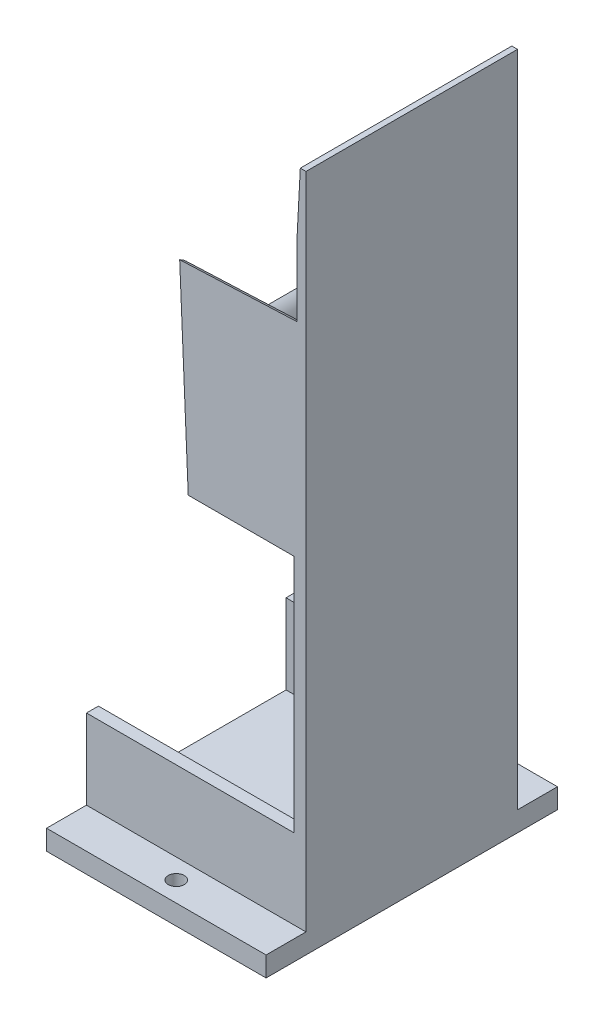
from build123d import *

# Parameters (mm, degrees)
CROQUIS1_W              = 55
CROQUIS1_H              = 53
CROQUIS1_W_2            = 48.773584906
CROQUIS1_H_2            = 47
SALIENTE_EXTRUIR1_DEPTH = 25
SALIENTE_EXTRUIR2_DEPTH = 160
SALIENTE_EXTRUIR3_DEPTH = 50
SALIENTE_EXTRUIR5_DEPTH = 3
CROQUIS4_W              = 100
CROQUIS4_H              = 30
CORTAR_EXTRUIR1_DEPTH   = 63
CHAFL_N1_SIZE           = 2
CHAFL_N1_SIZE2          = 57.272506566
CROQUIS1_2_W            = 55
CROQUIS1_2_H            = 53
CROQUIS1_2_W_2          = 48.773584906
CROQUIS1_2_H_2          = 47
SALIENTE_EXTRUIR6_DEPTH = 5
CROQUIS5_W              = 30
CROQUIS5_H              = 60
CORTAR_EXTRUIR2_DEPTH   = 60
CROQUIS1_4_W            = 55
CROQUIS1_4_H            = 10
CROQUIS1_4_R            = 2
SALIENTE_EXTRUIR7_DEPTH = 5
CROQUIS6_W              = 53
CROQUIS6_H              = 15
CORTAR_EXTRUIR3_DEPTH   = 5
CHAFL_N2_SIZE           = 30
CHAFL_N2_SIZE_2         = 1.572233378
CHAFL_N3_SIZE           = 5
CHAFL_N3_SIZE2          = 0.881634904
CROQUIS7_W              = 47
CROQUIS7_H              = 20
CORTAR_EXTRUIR4_DEPTH   = 40
CROQUIS8_W              = 47
CROQUIS8_H              = 40
CORTAR_EXTRUIR5_DEPTH   = 10
CORTAR_EXTRUIR6_DEPTH   = 70
REDONDEO3_R             = 5
REDONDEO5_R             = 5


with BuildPart() as part:
    # Croquis1 → Saliente-Extruir1 (new body)
    with BuildSketch(Plane(origin=(0, 0, 0), x_dir=(1, 0, 0), z_dir=(0, 1, 0))):
        Rectangle(CROQUIS1_W, CROQUIS1_H)
        Rectangle(CROQUIS1_W_2, CROQUIS1_H_2, mode=Mode.SUBTRACT)
    extrude(amount=SALIENTE_EXTRUIR1_DEPTH)

    # Croquis2 → Saliente-Extruir2 (add)
    with BuildSketch(Plane(origin=(0, 25, 0), x_dir=(1, 0, 0), z_dir=(0, 1, 0))):
        Polygon((0, 23.5), (0, 26.5), (27.5, 26.5), (27.5, -26.5), (0, -26.5), (0, -23.5), (24.386792453, -23.5), (24.386792453, 23.5), align=None)
    extrude(amount=SALIENTE_EXTRUIR2_DEPTH)



with BuildPart() as body_2:
    # Croquis3 → Saliente-Extruir3 (new body)
    with BuildSketch(Plane(origin=(0, 0, 23.5), x_dir=(-1, 0, 0), z_dir=(0, 0, -1))):
        Polygon((0, 155), (5, 155), (2, 85), (0, 85), align=None)
    extrude(amount=SALIENTE_EXTRUIR3_DEPTH)


with BuildPart() as part_1:
    add(part.part)

    add(body_2.part)  # Saliente-Extruir5 merges body 2
    # Croquis3<4> → Saliente-Extruir5 (add)
    with BuildSketch(Plane(origin=(0, 0, 23.5), x_dir=(-1, 0, 0), z_dir=(0, 0, -1))):
        Polygon((0, 155), (5, 155), (2, 85), (0, 85), align=None)
    extrude(amount=-SALIENTE_EXTRUIR5_DEPTH)

    # Croquis4 → Cortar-Extruir1 (cut)
    with BuildSketch(Plane(origin=(0, 0, -26.5), x_dir=(-1, 0, 0), z_dir=(0, 0, -1))):
        with Locations((25.5, 170)):
            Rectangle(CROQUIS4_W, CROQUIS4_H)
    extrude(amount=-CORTAR_EXTRUIR1_DEPTH, mode=Mode.SUBTRACT)

    # Chaflán1
    chafl_n1_edges = [part_1.edges().sort_by_distance(p)[0] for p in [
        (0, 155, 0),
    ]]
    chafl_n1_side = [part_1.faces().sort_by_distance(p)[0] for p in [
        (9.75, 155, -25.893431785),
    ]]
    chamfer(chafl_n1_edges, length=CHAFL_N1_SIZE, length2=CHAFL_N1_SIZE2, reference=chafl_n1_side[0])

    # Croquis1<2> → Saliente-Extruir6 (add)
    # profile 1 of 2: a face of its own
    with BuildSketch(Plane(origin=(0, 0, 0), x_dir=(1, 0, 0), z_dir=(0, 1, 0))):
        Rectangle(CROQUIS1_2_W, CROQUIS1_2_H)
        Rectangle(CROQUIS1_2_W_2, CROQUIS1_2_H_2, mode=Mode.SUBTRACT)
    # profile 2 of 2: a face of its own
    with BuildSketch(Plane(origin=(0, 0, 0), x_dir=(1, 0, 0), z_dir=(0, 1, 0))):
        Rectangle(CROQUIS1_2_W_2, CROQUIS1_2_H_2)
    extrude(amount=SALIENTE_EXTRUIR6_DEPTH)

    # Croquis5 → Cortar-Extruir2 (cut)
    with BuildSketch(Plane(origin=(0, 0, -26.5), x_dir=(-1, 0, 0), z_dir=(0, 0, -1))):
        with Locations((-9.5, 55)):
            Rectangle(CROQUIS5_W, CROQUIS5_H)
    extrude(amount=-CORTAR_EXTRUIR2_DEPTH, mode=Mode.SUBTRACT)

    # Croquis1<4> → Saliente-Extruir7 (add)
    # profile 1 of 2: a face of its own
    with BuildSketch(Plane(origin=(0, 0, 0), x_dir=(1, 0, 0), z_dir=(0, 1, 0))):
        with Locations((0, 31.5)):
            Rectangle(CROQUIS1_4_W, CROQUIS1_4_H)
        with Locations(Location((0, 31.5, 0), (0, 0, 270))):
            Circle(CROQUIS1_4_R, mode=Mode.SUBTRACT)
    # profile 2 of 2: a face of its own
    with BuildSketch(Plane(origin=(0, 0, 0), x_dir=(1, 0, 0), z_dir=(0, 1, 0))):
        with Locations((0, -31.5)):
            Rectangle(CROQUIS1_4_W, CROQUIS1_4_H)
        with Locations(Location((0, -31.5, 0), (0, 0, 270))):
            Circle(CROQUIS1_4_R, mode=Mode.SUBTRACT)
    extrude(amount=SALIENTE_EXTRUIR7_DEPTH)

    # Croquis6 → Cortar-Extruir3 (cut)
    with BuildSketch(Plane.ZY.offset(-24.5)):
        with Locations((0, 177.5)):
            Rectangle(CROQUIS6_W, CROQUIS6_H)
    extrude(amount=-CORTAR_EXTRUIR3_DEPTH, mode=Mode.SUBTRACT)

    # Chaflán2
    # the kernel refuses this chamfer: 30, 1.572233378 mm, written as the material it takes off along each edge
    with BuildSketch(Plane(origin=(24.5, 170, -104.496046635), x_dir=(-0.002013023422382327, -0.9999979738662979, 0), z_dir=(0, 0, 1))) as chafl_n2_piece_1_section:
        Polygon((CHAFL_N2_SIZE * 0.999997973866, CHAFL_N2_SIZE * 0.00201302342238), (-CHAFL_N2_SIZE_2 * 0.00201302342301, CHAFL_N2_SIZE_2 * 0.999997974179), (0, 0), align=None)
    chafl_n2_piece_1 = extrude(amount=208.992093269, mode=Mode.PRIVATE)
    chafl_n2_piece_1 = split(chafl_n2_piece_1, bisect_by=Plane(origin=(25.111424092, 155, 0), z_dir=(0, 1, 0)), keep=Keep.TOP, mode=Mode.PRIVATE)
    add(chafl_n2_piece_1, mode=Mode.SUBTRACT)

    # Chaflán3
    chafl_n3_edges = [part_1.edges().sort_by_distance(p)[0] for p in [
        (24.386792453, 155, 0),
    ]]
    chafl_n3_side = [part_1.faces().sort_by_distance(p)[0] for p in [
        (24.386792453, 120, 0),
    ]]
    chamfer(chafl_n3_edges, length=CHAFL_N3_SIZE, length2=CHAFL_N3_SIZE2, reference=chafl_n3_side[0])

    # Croquis7 → Cortar-Extruir4 (cut)
    with BuildSketch(Plane.ZY.offset(27.5)):
        with Locations((0, 15)):
            Rectangle(CROQUIS7_W, CROQUIS7_H)
    extrude(amount=-CORTAR_EXTRUIR4_DEPTH, mode=Mode.SUBTRACT)

    # Croquis8 → Cortar-Extruir5 (cut)
    with BuildSketch(Plane(origin=(1.639845182, 0.070279079, 0), x_dir=(0, 0, 1), z_dir=(-0.9990828958176697, -0.04281783839218585, 0))):
        with Locations((0, 135.071938044)):
            Rectangle(CROQUIS8_W, CROQUIS8_H)
    extrude(amount=-CORTAR_EXTRUIR5_DEPTH, mode=Mode.SUBTRACT)

    # Croquis9 → Cortar-Extruir6 (cut)
    with BuildSketch(Plane.XY.offset(26.5)):
        Polygon((-5, 155), (25.286116689, 155), (25.286116689, 136.279617509), (-4.143643232, 135.018342084), align=None)
    extrude(amount=-CORTAR_EXTRUIR6_DEPTH, mode=Mode.SUBTRACT)

    # Redondeo3
    # the kernel refuses this fillet: 5 mm, written as the material it takes off along each edge
    with BuildSketch(Plane(origin=(-4.143643232, 135.018342084, 23.5), x_dir=(0, 0, 1), z_dir=(0.9990828958176697, 0.042817838392185704, 0))) as redondeo3_piece_1_section:
        with BuildLine():
            CenterArc((5, 4.582575695), REDONDEO3_R, 180, 66.421821522)
            Line((0, 4.582575695), (-0.1, 4.582575695))
            Line((-0.1, 4.582575695), (-0.1, 0))
            Line((-0.1, 0), (0, -0.1))
            ThreePointArc((0, -0.1), (1.5, -0.1), (2.96, -0.091651514))
            Line((2.96, -0.091651514), (3, 0))
        make_face()
    redondeo3_piece_1 = extrude(amount=40.013064323, mode=Mode.PRIVATE)
    redondeo3_piece_1 = split(redondeo3_piece_1, bisect_by=Plane(origin=(24.386792453, 134.515316135, 24.276456874), z_dir=(-1, 0, 0)), keep=Keep.TOP, mode=Mode.PRIVATE)
    add(redondeo3_piece_1, mode=Mode.SUBTRACT)
    with BuildSketch(Plane(origin=(24.386792453, 136.241075042, 23.5), x_dir=(0.9990828958176863, 0.04281783839180005, 0), z_dir=(0, 0, -1))) as redondeo3_piece_2:
        with BuildLine():
            CenterArc((4.874569404, 3.033807599), REDONDEO3_R, 182.454031675, 34.901674654)
            Line((-0.120845075, 2.819718407), (-0.220753364, 2.815436623))
            Line((-0.220753364, 2.815436623), (-0.09990829, -0.004281784))
            Line((-0.09990829, -0.004281784), (0, -0.1))
            ThreePointArc((0, -0.1), (0.450074884, -0.1), (0.820661375, -0.060676152))
            Line((0.820661375, -0.060676152), (0.900149768, 0))
        make_face()
    extrude(amount=47, mode=Mode.SUBTRACT)
    with BuildSketch(Plane(origin=(35.832724942, 136.731615005, -23.5), x_dir=(0.0428178383921857, -0.9990828958176697, 0), z_dir=(-0.9990828958176697, -0.042817838392185704, 0))) as redondeo3_piece_3_section:
        with BuildLine():
            CenterArc((4.582575695, -5), REDONDEO3_R, 90, 66.421821522)
            Line((0, -3), (-0.091651514, -2.96))
            ThreePointArc((-0.091651514, -2.96), (-0.1, -1.5), (-0.1, 0))
            Line((-0.1, 0), (0, 0.1))
            Line((0, 0.1), (4.582575695, 0.1))
            Line((4.582575695, 0.1), (4.582575695, 0))
        make_face()
    redondeo3_piece_3 = extrude(amount=40.013064323, mode=Mode.PRIVATE)
    redondeo3_piece_3 = split(redondeo3_piece_3, bisect_by=Plane(origin=(24.386792453, 134.515316135, -24.276456874), z_dir=(-1, 0, 0)), keep=Keep.TOP, mode=Mode.PRIVATE)
    add(redondeo3_piece_3, mode=Mode.SUBTRACT)
    with BuildSketch(Plane(origin=(-4.143643232, 135.018342084, 23.5), x_dir=(0, 0, 1), z_dir=(0.9990828958176697, 0.042817838392185704, 0))) as redondeo3_piece_4a_section:
        with BuildLine():
            CenterArc((5, 4.582575695), REDONDEO3_R, 180, 66.421821522)
            Line((0, 4.582575695), (-0.1, 4.582575695))
            Line((-0.1, 4.582575695), (-0.1, 0))
            Line((-0.1, 0), (0, -0.1))
            ThreePointArc((0, -0.1), (1.5, -0.1), (2.96, -0.091651514))
            Line((2.96, -0.091651514), (3, 0))
        make_face()
    redondeo3_piece_4a = extrude(amount=40.013064323, mode=Mode.PRIVATE)
    redondeo3_piece_4a = split(redondeo3_piece_4a, bisect_by=Plane(origin=(24.386792453, 135.366576267, 24.274229372), z_dir=(1, 0, 0)), keep=Keep.TOP, mode=Mode.PRIVATE)
    with BuildSketch(Plane(origin=(24.386792453, 136.241075042, 30.555766892), x_dir=(0.9990828958176863, 0.04281783839180005, 0), z_dir=(0, 0, -1))) as redondeo3_piece_4b_section:
        with BuildLine():
            CenterArc((4.874569404, 3.033807599), REDONDEO3_R, 182.454031675, 34.901674654)
            Line((-0.120845075, 2.819718407), (-0.220753364, 2.815436623))
            Line((-0.220753364, 2.815436623), (-0.09990829, -0.004281784))
            Line((-0.09990829, -0.004281784), (0, -0.1))
            ThreePointArc((0, -0.1), (0.450074884, -0.1), (0.820661375, -0.060676152))
            Line((0.820661375, -0.060676152), (0.900149768, 0))
        make_face()
    redondeo3_piece_4b = extrude(amount=54.055766892, mode=Mode.PRIVATE)
    redondeo3_piece_4b = split(redondeo3_piece_4b, bisect_by=Plane(origin=(24.583130189, 135.440658169, 23.5), z_dir=(0, 0, 1)), keep=Keep.TOP, mode=Mode.PRIVATE)
    redondeo3_piece_4 = redondeo3_piece_4a & redondeo3_piece_4b
    add(redondeo3_piece_4, mode=Mode.SUBTRACT)
    with BuildSketch(Plane(origin=(35.832724942, 136.731615005, -23.5), x_dir=(0.0428178383921857, -0.9990828958176697, 0), z_dir=(-0.9990828958176697, -0.042817838392185704, 0))) as redondeo3_piece_5a_section:
        with BuildLine():
            CenterArc((4.582575695, -5), REDONDEO3_R, 90, 66.421821522)
            Line((0, -3), (-0.091651514, -2.96))
            ThreePointArc((-0.091651514, -2.96), (-0.1, -1.5), (-0.1, 0))
            Line((-0.1, 0), (0, 0.1))
            Line((0, 0.1), (4.582575695, 0.1))
            Line((4.582575695, 0.1), (4.582575695, 0))
        make_face()
    redondeo3_piece_5a = extrude(amount=40.013064323, mode=Mode.PRIVATE)
    redondeo3_piece_5a = split(redondeo3_piece_5a, bisect_by=Plane(origin=(24.386792453, 135.366576267, -24.274229372), z_dir=(1, 0, 0)), keep=Keep.TOP, mode=Mode.PRIVATE)
    with BuildSketch(Plane(origin=(24.386792453, 136.241075042, 23.5), x_dir=(0.9990828958176863, 0.04281783839180005, 0), z_dir=(0, 0, -1))) as redondeo3_piece_5b_section:
        with BuildLine():
            CenterArc((4.874569404, 3.033807599), REDONDEO3_R, 182.454031675, 34.901674654)
            Line((-0.120845075, 2.819718407), (-0.220753364, 2.815436623))
            Line((-0.220753364, 2.815436623), (-0.09990829, -0.004281784))
            Line((-0.09990829, -0.004281784), (0, -0.1))
            ThreePointArc((0, -0.1), (0.450074884, -0.1), (0.820661375, -0.060676152))
            Line((0.820661375, -0.060676152), (0.900149768, 0))
        make_face()
    redondeo3_piece_5b = extrude(amount=54.055766892, mode=Mode.PRIVATE)
    redondeo3_piece_5b = split(redondeo3_piece_5b, bisect_by=Plane(origin=(24.583130189, 135.440658169, -23.5), z_dir=(0, 0, -1)), keep=Keep.TOP, mode=Mode.PRIVATE)
    redondeo3_piece_5 = redondeo3_piece_5a & redondeo3_piece_5b
    add(redondeo3_piece_5, mode=Mode.SUBTRACT)

    # Redondeo5
    # the kernel refuses this fillet: 5 mm, written as the material it takes off along each edge
    with BuildSketch(Plane(origin=(-0.608459404, 115.151491041, -23.5), x_dir=(-0.9990828958176692, -0.04281783839219633, 0), z_dir=(0, 0, 1))) as redondeo5_piece_1:
        with BuildLine():
            CenterArc((5.035114331, 4.411291484), REDONDEO5_R, 179.545968325, 62.370023628)
            Line((0.035271319, 4.450912808), (0, 0))
            Line((0, 0), (2.681286079, 0))
        make_face()
    extrude(amount=47, mode=Mode.SUBTRACT)


solid = part_1.part
